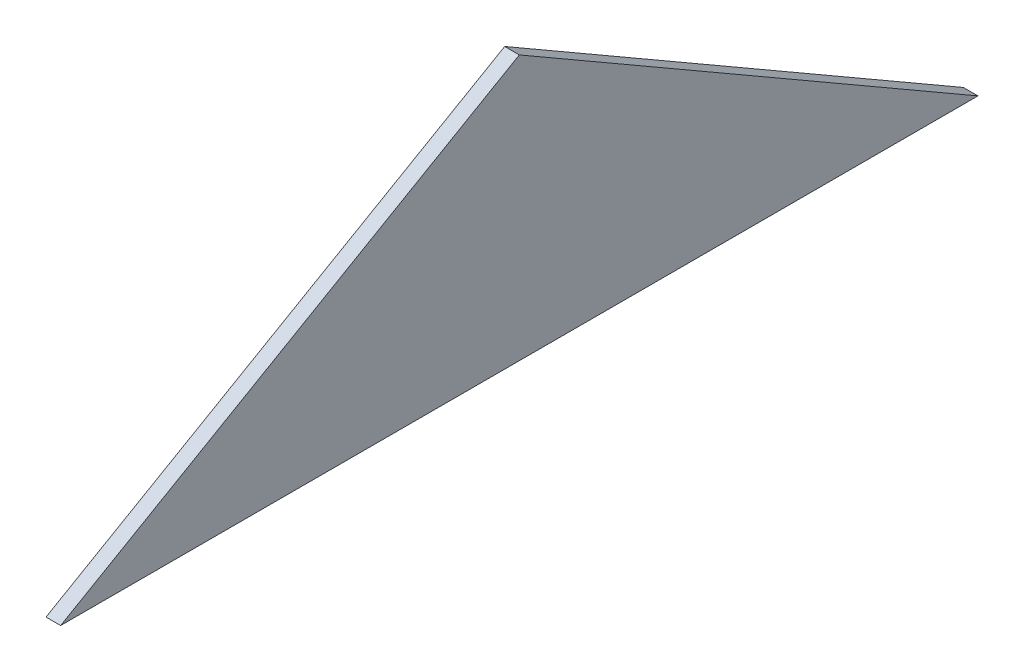
from build123d import *

# Parameters (mm, degrees)
BOSS_EXTRUDE1_DEPTH = 3


with BuildPart() as part:
    # Sketch1 → Boss-Extrude1 (new body)
    with BuildSketch(Plane(origin=(0, 0, 0), x_dir=(0, 0, -1), z_dir=(1, 0, 0))):
        Polygon((-94, 0), (94, 0), (0, 54.270925304), align=None)
    extrude(amount=BOSS_EXTRUDE1_DEPTH)


solid = part.part
